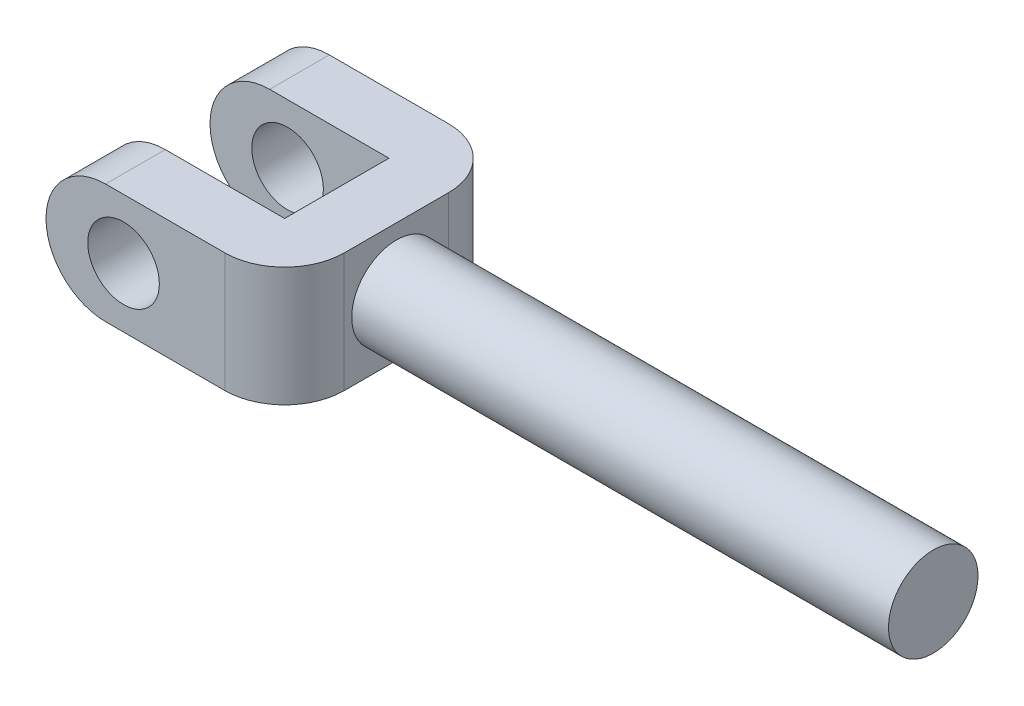
from build123d import *

# Parameters (mm, degrees)
SKETCH1_R                = 0.75
BOSS_EXTRUDE1_DEPTH      = 10
BOSS_EXTRUDE2_DEPTH      = 1
BOSS_EXTRUDE2_DEPTH_BACK = 1
FILLET1_R                = 1
SKETCH3_R                = 0.6
CUT_EXTRUDE1_DEPTH       = 5


with BuildPart() as part:
    # Sketch1 → Boss-Extrude1 (new body)
    with BuildSketch(Plane(origin=(0, 0, 0), x_dir=(0, 0, -1), z_dir=(1, 0, 0))):
        Circle(SKETCH1_R)
    extrude(amount=BOSS_EXTRUDE1_DEPTH)

    # Sketch2 → Boss-Extrude2 (add, two sides: drawn at the far end of the back side and taken through both)
    with BuildSketch(Plane(origin=(0, 0, 0), x_dir=(1, 0, 0), z_dir=(0, 1, 0)).offset(-BOSS_EXTRUDE2_DEPTH_BACK)):
        Polygon((1, 1.875), (1, -1.875), (-3, -1.875), (-3, -0.875), (0, -0.875), (0, 0.875), (-3, 0.875), (-3, 1.875), align=None)
    extrude(amount=BOSS_EXTRUDE2_DEPTH + BOSS_EXTRUDE2_DEPTH_BACK)

    # Fillet1
    fillet1_edges = [part.edges().sort_by_distance(p)[0] for p in [
        (-3, 1, -1.375),
        (-3, -1, -1.375),
        (-3, -1, 1.375),
        (-3, 1, 1.375),
        (1, 0, -1.875),
        (1, 0, 1.875),
    ]]
    fillet(fillet1_edges, radius=FILLET1_R - 0.0001)  # a hair under: the kernel refuses the full size

    # Sketch3 → Cut-Extrude1 (cut)
    with BuildSketch(Plane(origin=(0, 0, -1.875), x_dir=(-1, 0, 0), z_dir=(0, 0, -1))):
        with Locations((1.7, 0)):
            Circle(SKETCH3_R)
    extrude(amount=-CUT_EXTRUDE1_DEPTH, mode=Mode.SUBTRACT)


solid = part.part
